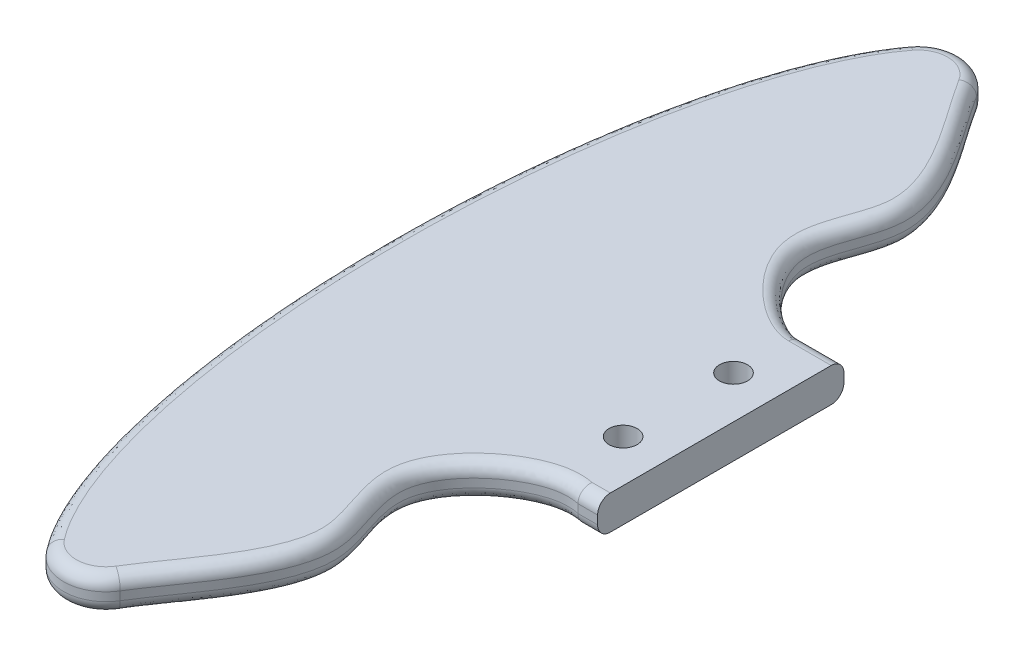
from build123d import *

# Parameters (mm, degrees)
BOSS_EXTRUDE1_DEPTH      = 4
CUT_EXTRUDE3_DEPTH       = 10
FILLET1_R                = 5
FILLET2_R                = 5
FILLET4_R                = 1.5
FILLET5_R                = 1.5
SKETCH8_R                = 1.65
M3_SCREWS_NO_ANGLE_DEPTH = 58.295865217


with BuildPart() as part:
    # Sketch1 → Boss-Extrude1 (new body)
    with BuildSketch(Plane(origin=(0, 0, 0), x_dir=(1, 0, 0), z_dir=(0, 1, 0))):
        with BuildLine():
            Line((16.880887403, -14.5), (21.880887403, -14.5))
            Line((21.880887403, -14.5), (21.880887403, 14.5))
            Line((21.880887403, 14.5), (16.880887403, 14.5))
            add(Edge.make_bspline(
                [(16.880887403, 14.5), (10.315205407, 90.001641988), (-10.061420815, 45.000820994), (-30.438047036, 0), (-10.061420815, -45.000820994), (10.315205407, -90.001641988), (16.880887403, -14.5)],
                knots=[1.837586327, 1.837586327, 1.837586327, 3.754121429, 3.754121429, 5.670656531, 5.670656531, 7.587191634, 7.587191634, 7.587191634], degree=2, weights=[1, 0.574938332, 1, 0.574938332, 1, 0.574938332, 1]))
        make_face()
    extrude(amount=BOSS_EXTRUDE1_DEPTH)

    # Sketch7 → Cut-Extrude3 (cut)
    with BuildSketch(Plane(origin=(0, 4, 0), x_dir=(1, 0, 0), z_dir=(0, 1, 0))):
        with BuildLine():
            add(Edge.make_bspline(
                [(23.14227403, 35.5), (18.099358539, 28.537011918), (23.696184015, 6.625507918), (4.306299207, 22.680417047), (15.57904794, 37.098876778), (-21.537333626, 68.37702066), (62.216195995, 43.763137081), (27.53995378, 41.57208107), (23.14227403, 35.5)],
                knots=[0, 0, 0, 0, 0.169799327, 0.265053464, 0.346195378, 0.531482099, 0.851926319, 1, 1, 1, 1], degree=3))
        make_face()
        with BuildLine():
            add(Edge.make_bspline(
                [(16.880887403, -14.5), (13.23497009, -15.264594801), (4.678228769, -22.363386384), (15.30409302, -37.401746243), (-20.755744413, -66.732109381), (50.878650468, -53.022873726), (29.559312603, -31.585281871), (25.018542326, -12.793431223), (16.880887403, -14.5)],
                knots=[0, 0, 0, 0, 0.097566453, 0.180678106, 0.370462705, 0.698685782, 0.782232547, 1, 1, 1, 1], degree=3))
        make_face()
    extrude(amount=-CUT_EXTRUDE3_DEPTH, mode=Mode.SUBTRACT)

    # Fillet1
    fillet1_edges = [part.edges().sort_by_distance(p)[0] for p in [
        (0, 2, -55),
    ]]
    fillet(fillet1_edges, radius=FILLET1_R)

    # Fillet2
    fillet2_edges = [part.edges().sort_by_distance(p)[0] for p in [
        (0, 2, 55),
    ]]
    fillet(fillet2_edges, radius=FILLET2_R)

    # Fillet4
    fillet4_edges = [part.edges().sort_by_distance(p)[0] for p in [
        (-2.490410136, 4, 52.732829352),
        (-2.456510296, 4, -52.795729821),
        (-17.499991927, 4, -0.052830275),
        (20.721778798, 4, 14.5),
        (9.710717146, 4, 31.25012564),
        (9.677756323, 4, -31.292902199),
    ]]
    fillet(fillet4_edges, radius=FILLET4_R)

    # Fillet5
    fillet5_edges = [part.edges().sort_by_distance(p)[0] for p in [
        (-2.490410136, 0, 52.732829352),
        (-2.456510296, 0, -52.795729821),
        (-17.499991927, 0, -0.052830275),
        (20.721778798, 0, 14.5),
        (9.710717149, 0, 31.25012565),
        (9.677756314, 0, -31.292902088),
    ]]
    fillet(fillet5_edges, radius=FILLET5_R)

    # Sketch8 → M3 Screws no Angle (cut, through all)
    with BuildSketch(Plane(origin=(0, 4, 0), x_dir=(1, 0, 0), z_dir=(0, 1, 0))):
        with Locations((16.880887403, -6.5)):
            Circle(SKETCH8_R)
        with Locations((16.880887403, 6.5)):
            Circle(SKETCH8_R)
    extrude(amount=-M3_SCREWS_NO_ANGLE_DEPTH, mode=Mode.SUBTRACT)


solid = part.part
